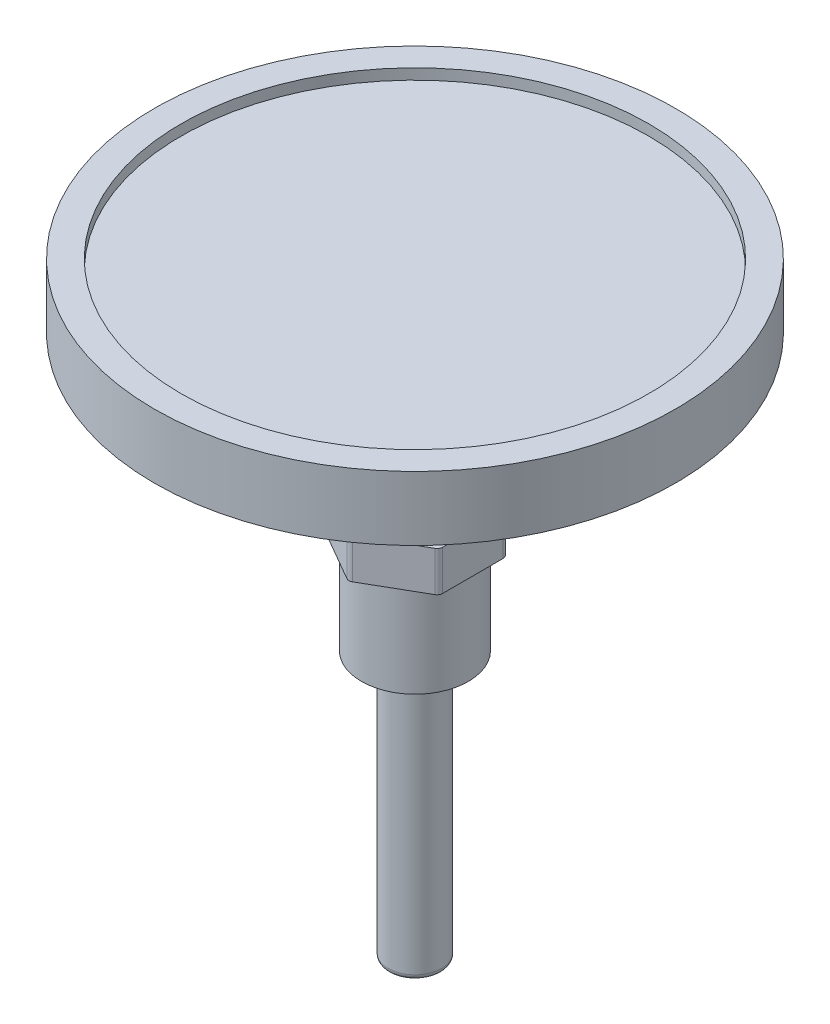
from build123d import *

# Parameters (mm, degrees)
SKETCH1_R           = 5
BOSS_EXTRUDE1_DEPTH = 50
SKETCH2_R           = 10
BOSS_EXTRUDE2_DEPTH = 17.5
BOSS_EXTRUDE3_DEPTH = 7.5
SKETCH4_R           = 8.5
BOSS_EXTRUDE4_DEPTH = 16.5
SKETCH5_R           = 20
BOSS_EXTRUDE5_DEPTH = 10
SKETCH6_R           = 48.75
BOSS_EXTRUDE6_DEPTH = 12
CHAMFER1_SIZE2      = 10
CHAMFER1_SIZE       = 14.281480067
SKETCH7_R           = 43.75
CUT_EXTRUDE2_DEPTH  = 2
FILLET1_R           = 1


with BuildPart() as part:
    # Sketch1 → Boss-Extrude1 (new body)
    with BuildSketch(Plane(origin=(0, 0, 0), x_dir=(1, 0, 0), z_dir=(0, 1, 0))):
        with Locations(Location((0, 0, 0), (0, 0, 270))):
            Circle(SKETCH1_R)
    extrude(amount=BOSS_EXTRUDE1_DEPTH)

    # Sketch2 → Boss-Extrude2 (add)
    with BuildSketch(Plane(origin=(0, 50, 0), x_dir=(1, 0, 0), z_dir=(0, 1, 0))):
        with Locations(Location((0, 0, 0), (0, 0, 270))):
            Circle(SKETCH2_R)
    extrude(amount=BOSS_EXTRUDE2_DEPTH)

    # Sketch3 → Boss-Extrude3 (add)
    with BuildSketch(Plane(origin=(0, 67.5, 0), x_dir=(1, 0, 0), z_dir=(0, 1, 0))):
        Polygon((10.825317547, -6.25), (10.825317547, 6.25), (0, 12.5), (-10.825317547, 6.25), (-10.825317547, -6.25), (0, -12.5), align=None)
    extrude(amount=BOSS_EXTRUDE3_DEPTH)

    # Sketch4 → Boss-Extrude4 (add)
    with BuildSketch(Plane(origin=(0, 75, 0), x_dir=(1, 0, 0), z_dir=(0, 1, 0))):
        with Locations(Location((0, 0, 0), (0, 0, 270))):
            Circle(SKETCH4_R)
    extrude(amount=BOSS_EXTRUDE4_DEPTH)

    # Sketch5 → Boss-Extrude5 (add)
    with BuildSketch(Plane(origin=(0, 91.5, 0), x_dir=(1, 0, 0), z_dir=(0, 1, 0))):
        with Locations(Location((0, 0, 0), (0, 0, 270))):
            Circle(SKETCH5_R)
    extrude(amount=BOSS_EXTRUDE5_DEPTH)

    # Sketch6 → Boss-Extrude6 (add)
    with BuildSketch(Plane(origin=(0, 101.5, 0), x_dir=(1, 0, 0), z_dir=(0, 1, 0))):
        with Locations(Location((0, 0, 0), (0, 0, 270))):
            Circle(SKETCH6_R)
    extrude(amount=BOSS_EXTRUDE6_DEPTH)

    # Chamfer1
    chamfer1_edges = [part.edges().sort_by_distance(p)[0] for p in [
        (0, 101.5, -20),
    ]]
    chamfer1_side = [part.faces().sort_by_distance(p)[0] for p in [
        (0, 101.5, -20.2),
    ]]
    chamfer(chamfer1_edges, length=CHAMFER1_SIZE - 0.0001, length2=CHAMFER1_SIZE2 - 0.0001, reference=chamfer1_side[0])  # a hair under: the kernel refuses the full size

    # Sketch7 → Cut-Extrude2 (cut)
    with BuildSketch(Plane(origin=(0, 113.5, 0), x_dir=(1, 0, 0), z_dir=(0, 1, 0))):
        with Locations(Location((0, 0, 0), (0, 0, 270))):
            Circle(SKETCH7_R)
    extrude(amount=-CUT_EXTRUDE2_DEPTH, mode=Mode.SUBTRACT)

    # Fillet1
    fillet1_edges = [part.edges().sort_by_distance(p)[0] for p in [
        (0, 71.25, 12.5),
        (10.825317547, 71.25, 6.25),
        (10.825317547, 71.25, -6.25),
        (0, 71.25, -12.5),
        (-10.825317547, 71.25, -6.25),
        (-10.825317547, 71.25, 6.25),
        (0, 0, -5),
    ]]
    fillet(fillet1_edges, radius=FILLET1_R)


solid = part.part
